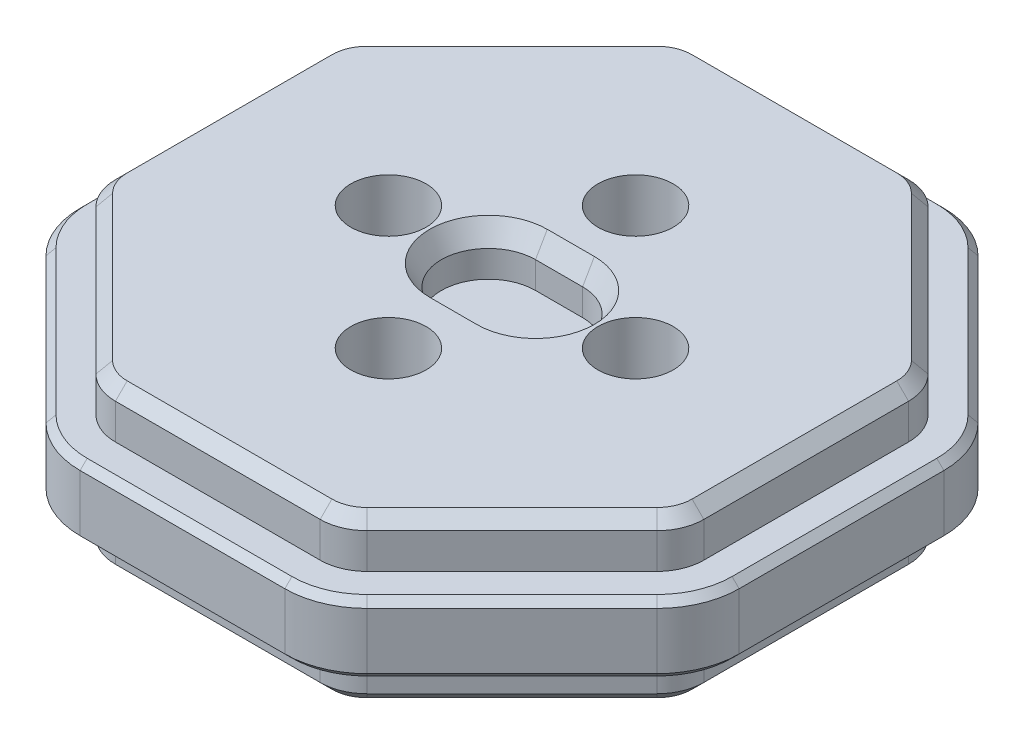
from build123d import *

# Parameters (mm, degrees)
EXTRUDE_1_DEPTH              = 7
HOLE_WIZARD_M3_2_D           = 3.2
HOLE_WIZARD_M3_2_DEPTH       = 7
HOLE_WIZARD_M3_2_CBORE_D     = 6.2
HOLE_WIZARD_M3_2_CBORE_DEPTH = 1.3
HOLE_WIZARD_M3_2_TIP         = 0.96137699
CUT_EXTRUDE_1_DEPTH          = 2
EXTRUDE_START                = -3.5
EXTRUDE_3_DEPTH              = 1.5
FILLET_1_R                   = 2
CHAMFER_1_SIZE               = 0.5
CHAMFER_1_SIZE2              = 0.866025404
FILLET_2_R                   = 1
CHAMFER_2_SIZE               = 0.5
DELETE_START                 = 2
DELETE_FACE_1_DEPTH          = 3
DELETE_FACE_2_DEPTH          = 3
FILLET_3_R                   = 3.5
CHAMFER_3_SIZE               = 0.3


with BuildPart() as part:
    # 草图1 → 凸台-拉伸1 (new body)
    with BuildSketch(Plane(origin=(0, 0, 0), x_dir=(1, 0, 0), z_dir=(0, 1, 0))):
        Polygon((12.5, -5.17766953), (12.5, 5.17766953), (5.17766953, 12.5), (-5.17766953, 12.5), (-12.5, 5.17766953), (-12.5, -5.17766953), (-5.17766953, -12.5), (5.17766953, -12.5), align=None)
    extrude(amount=EXTRUDE_1_DEPTH)

    # M3 六角圆柱头螺钉的柱形沉头孔2
    with Locations(Plane.XZ):
        with Locations((-5.25, 0), (0, 5.25), (5.25, 0), (0, -5.25)):
            CounterBoreHole(HOLE_WIZARD_M3_2_D / 2, HOLE_WIZARD_M3_2_CBORE_D / 2, HOLE_WIZARD_M3_2_CBORE_DEPTH, depth=HOLE_WIZARD_M3_2_DEPTH)
            with Locations((0, 0, -(HOLE_WIZARD_M3_2_DEPTH + HOLE_WIZARD_M3_2_TIP / 2))):  # 118° drill point
                Cone(0, HOLE_WIZARD_M3_2_D / 2, HOLE_WIZARD_M3_2_TIP, mode=Mode.SUBTRACT)

    # 草图7 → 切除-拉伸1 (cut)
    with BuildSketch(Plane(origin=(0, 7, 0), x_dir=(1, 0, 0), z_dir=(0, 1, 0))):
        with BuildLine():
            Line((-1, 2), (1, 2))
            ThreePointArc((1, 2), (3, 0), (1, -2))
            Line((1, -2), (-1, -2))
            ThreePointArc((-1, -2), (-3, 0), (-1, 2))
        make_face()
    extrude(amount=-CUT_EXTRUDE_1_DEPTH, mode=Mode.SUBTRACT)

    # 草图8 → 凸台-拉伸3 (add, symmetric)
    with BuildSketch(Plane(origin=(0, 7, 0), x_dir=(1, 0, 0), z_dir=(0, 1, 0)).offset(EXTRUDE_START)):
        Polygon((5.798989873, 14), (-5.798989873, 14), (-14, 5.798989873), (-14, -5.798989873), (-5.798989873, -14), (5.798989873, -14), (14, -5.798989873), (14, 5.798989873), align=None)
        Polygon((12.5, 5.17766953), (5.17766953, 12.5), (-5.17766953, 12.5), (-12.5, 5.17766953), (-12.5, -5.17766953), (-5.17766953, -12.5), (5.17766953, -12.5), (12.5, -5.17766953), align=None, mode=Mode.SUBTRACT)
    extrude(amount=EXTRUDE_3_DEPTH, both=True)

    # 圆角1
    fillet_1_edges = [part.edges().sort_by_distance(p)[0] for p in [
        (5.17766953, 6, 12.5),
        (-5.17766953, 6, 12.5),
        (-12.5, 6, 5.17766953),
        (-12.5, 6, -5.17766953),
        (-5.17766953, 6, -12.5),
        (5.17766953, 6, -12.5),
        (12.5, 6, -5.17766953),
        (12.5, 6, 5.17766953),
        (5.17766953, 1, 12.5),
        (-5.17766953, 1, 12.5),
        (-12.5, 1, 5.17766953),
        (-12.5, 1, -5.17766953),
        (-5.17766953, 1, -12.5),
        (5.17766953, 1, -12.5),
        (12.5, 1, -5.17766953),
        (12.5, 1, 5.17766953),
        (14, 3.5, -5.798989873),
        (5.798989873, 3.5, -14),
        (-5.798989873, 3.5, -14),
        (-14, 3.5, -5.798989873),
        (-14, 3.5, 5.798989873),
        (-5.798989873, 3.5, 14),
        (5.798989873, 3.5, 14),
        (14, 3.5, 5.798989873),
    ]]
    fillet(fillet_1_edges, radius=FILLET_1_R)

    # 倒角1
    chamfer_1_edges = [part.edges().sort_by_distance(p)[0] for p in [
        (-3, 7, 0),
        (0, 7, 2),
        (3, 7, 0),
        (0, 7, -2),
    ]]
    chamfer_1_side = [part.faces().sort_by_distance(p)[0] for p in [
        (12.146446609, 7, 0),
    ]]
    chamfer(chamfer_1_edges, length=CHAMFER_1_SIZE, length2=CHAMFER_1_SIZE2, reference=chamfer_1_side[0])

    # 圆角2
    fillet_2_edges = [part.edges().sort_by_distance(p)[0] for p in [
        (9.899494937, 2, -9.899494937),
        (9.899494937, 5, -9.899494937),
        (14, 2, 0),
        (9.899494937, 2, 9.899494937),
        (0, 2, 14),
        (-9.899494937, 2, 9.899494937),
        (-14, 2, 0),
        (-9.899494937, 2, -9.899494937),
        (0, 2, -14),
        (-13.847759065, 2, -5.735929613),
        (5.735929613, 2, -13.847759065),
        (-5.735929613, 2, -13.847759065),
        (-13.847759065, 2, 5.735929613),
        (-5.735929613, 2, 13.847759065),
        (5.735929613, 2, 13.847759065),
        (13.847759065, 2, 5.735929613),
        (13.847759065, 2, -5.735929613),
        (14, 5, 0),
        (0, 5, -14),
        (-9.899494937, 5, -9.899494937),
        (-14, 5, 0),
        (-9.899494937, 5, 9.899494937),
        (0, 5, 14),
        (9.899494937, 5, 9.899494937),
        (-13.847759065, 5, -5.735929613),
        (5.735929613, 5, -13.847759065),
        (-5.735929613, 5, -13.847759065),
        (-13.847759065, 5, 5.735929613),
        (-5.735929613, 5, 13.847759065),
        (5.735929613, 5, 13.847759065),
        (13.847759065, 5, 5.735929613),
        (13.847759065, 5, -5.735929613),
    ]]
    fillet(fillet_2_edges, radius=FILLET_2_R)

    # 倒角2
    chamfer_2_edges = [part.edges().sort_by_distance(p)[0] for p in [
        (12.5, 0, 0),
        (8.838834765, 0, 8.838834765),
        (0, 0, 12.5),
        (-8.838834765, 0, 8.838834765),
        (-12.5, 0, 0),
        (-8.838834765, 0, -8.838834765),
        (0, 0, -12.5),
        (8.838834765, 0, -8.838834765),
        (-12.347759065, 0, -5.11460927),
        (12.347759065, 0, -5.11460927),
        (5.11460927, 0, -12.347759065),
        (-5.11460927, 0, -12.347759065),
        (-12.347759065, 0, 5.11460927),
        (-5.11460927, 0, 12.347759065),
        (5.11460927, 0, 12.347759065),
        (12.347759065, 0, 5.11460927),
        (0, 7, 12.5),
        (-8.838834765, 7, 8.838834765),
        (8.838834765, 7, 8.838834765),
        (12.5, 7, 0),
        (8.838834765, 7, -8.838834765),
        (0, 7, -12.5),
        (-8.838834765, 7, -8.838834765),
        (-12.5, 7, 0),
        (12.347759065, 7, 5.11460927),
        (5.11460927, 7, 12.347759065),
        (12.347759065, 7, -5.11460927),
        (5.11460927, 7, -12.347759065),
        (-5.11460927, 7, -12.347759065),
        (-12.347759065, 7, -5.11460927),
        (-12.347759065, 7, 5.11460927),
        (-5.11460927, 7, 12.347759065),
    ]]
    chamfer(chamfer_2_edges, length=CHAMFER_2_SIZE)

    # Delete Face 1: read off the stored shape, not the designer's step
    # Delete Face 1 outline → Delete Face 1 (add)
    with BuildSketch(Plane(origin=(0, 0, 0), x_dir=(1, 0, 0), z_dir=(0, 1, 0)).offset(DELETE_START)):
        with BuildLine():
            ThreePointArc((13.414213562, -6.384776311), (13.847759065, -5.735929613), (14, -4.970562748))
            Line((14, -4.970562748), (14, 4.970562748))
            ThreePointArc((14, 4.970562748), (13.847759065, 5.735929613), (13.414213562, 6.384776311))
            Line((13.414213562, 6.384776311), (6.384776311, 13.414213562))
            ThreePointArc((6.384776311, 13.414213562), (5.735929613, 13.847759065), (4.970562748, 14))
            Line((4.970562748, 14), (-4.970562748, 14))
            ThreePointArc((-4.970562748, 14), (-5.735929613, 13.847759065), (-6.384776311, 13.414213562))
            Line((-6.384776311, 13.414213562), (-13.414213562, 6.384776311))
            ThreePointArc((-13.414213562, 6.384776311), (-13.847759065, 5.735929613), (-14, 4.970562748))
            Line((-14, 4.970562748), (-14, -4.970562748))
            ThreePointArc((-14, -4.970562748), (-13.847759065, -5.735929613), (-13.414213562, -6.384776311))
            Line((-13.414213562, -6.384776311), (-6.384776311, -13.414213562))
            ThreePointArc((-6.384776311, -13.414213562), (-5.735929613, -13.847759065), (-4.970562748, -14))
            Line((-4.970562748, -14), (4.970562748, -14))
            ThreePointArc((4.970562748, -14), (5.735929613, -13.847759065), (6.384776311, -13.414213562))
            Line((6.384776311, -13.414213562), (13.414213562, -6.384776311))
        make_face()
        with BuildLine():
            ThreePointArc((4.349242405, 12.5), (5.11460927, 12.347759065), (5.763455967, 11.914213562))
            Line((5.763455967, 11.914213562), (11.914213562, 5.763455967))
            ThreePointArc((11.914213562, 5.763455967), (12.347759065, 5.11460927), (12.5, 4.349242405))
            Line((12.5, 4.349242405), (12.5, -4.349242405))
            ThreePointArc((12.5, -4.349242405), (12.347759065, -5.11460927), (11.914213562, -5.763455967))
            Line((11.914213562, -5.763455967), (5.763455967, -11.914213562))
            ThreePointArc((5.763455967, -11.914213562), (5.11460927, -12.347759065), (4.349242405, -12.5))
            Line((4.349242405, -12.5), (-4.349242405, -12.5))
            ThreePointArc((-4.349242405, -12.5), (-5.11460927, -12.347759065), (-5.763455967, -11.914213562))
            Line((-5.763455967, -11.914213562), (-11.914213562, -5.763455967))
            ThreePointArc((-11.914213562, -5.763455967), (-12.347759065, -5.11460927), (-12.5, -4.349242405))
            Line((-12.5, -4.349242405), (-12.5, 4.349242405))
            ThreePointArc((-12.5, 4.349242405), (-12.347759065, 5.11460927), (-11.914213562, 5.763455967))
            Line((-11.914213562, 5.763455967), (-5.763455967, 11.914213562))
            ThreePointArc((-5.763455967, 11.914213562), (-5.11460927, 12.347759065), (-4.349242405, 12.5))
            Line((-4.349242405, 12.5), (4.349242405, 12.5))
        make_face(mode=Mode.SUBTRACT)
    extrude(amount=DELETE_FACE_1_DEPTH)

    # Delete Face 2: read off the stored shape, not the designer's step
    # Delete Face 2 outline → Delete Face 2 (add)
    with BuildSketch(Plane(origin=(0, 0, 0), x_dir=(1, 0, 0), z_dir=(0, 1, 0)).offset(DELETE_START)):
        with BuildLine():
            Line((14, 5.798989873), (13.414213562, 6.384776311))
            ThreePointArc((13.414213562, 6.384776311), (13.847759065, 5.735929613), (14, 4.970562748))
            Line((14, 4.970562748), (14, 5.798989873))
        make_face()
        with BuildLine():
            ThreePointArc((4.970562748, 14), (5.735929613, 13.847759065), (6.384776311, 13.414213562))
            Line((6.384776311, 13.414213562), (5.798989873, 14))
            Line((5.798989873, 14), (4.970562748, 14))
        make_face()
        with BuildLine():
            Line((14, -5.798989873), (14, -4.970562748))
            ThreePointArc((14, -4.970562748), (13.847759065, -5.735929613), (13.414213562, -6.384776311))
            Line((13.414213562, -6.384776311), (14, -5.798989873))
        make_face()
        with BuildLine():
            ThreePointArc((-6.384776311, 13.414213562), (-5.735929613, 13.847759065), (-4.970562748, 14))
            Line((-4.970562748, 14), (-5.798989873, 14))
            Line((-5.798989873, 14), (-6.384776311, 13.414213562))
        make_face()
        with BuildLine():
            Line((5.798989873, -14), (6.384776311, -13.414213562))
            ThreePointArc((6.384776311, -13.414213562), (5.735929613, -13.847759065), (4.970562748, -14))
            Line((4.970562748, -14), (5.798989873, -14))
        make_face()
        with BuildLine():
            ThreePointArc((-14, 4.970562748), (-13.847759065, 5.735929613), (-13.414213562, 6.384776311))
            Line((-13.414213562, 6.384776311), (-14, 5.798989873))
            Line((-14, 5.798989873), (-14, 4.970562748))
        make_face()
        with BuildLine():
            Line((-5.798989873, -14), (-4.970562748, -14))
            ThreePointArc((-4.970562748, -14), (-5.735929613, -13.847759065), (-6.384776311, -13.414213562))
            Line((-6.384776311, -13.414213562), (-5.798989873, -14))
        make_face()
        with BuildLine():
            ThreePointArc((-13.414213562, -6.384776311), (-13.847759065, -5.735929613), (-14, -4.970562748))
            Line((-14, -4.970562748), (-14, -5.798989873))
            Line((-14, -5.798989873), (-13.414213562, -6.384776311))
        make_face()
    extrude(amount=DELETE_FACE_2_DEPTH)

    # 圆角3
    fillet_3_edges = [part.edges().sort_by_distance(p)[0] for p in [
        (14, 3.5, -5.798989873),
        (14, 3.5, 5.798989873),
        (5.798989873, 3.5, 14),
        (-5.798989873, 3.5, 14),
        (-14, 3.5, 5.798989873),
        (-14, 3.5, -5.798989873),
        (-5.798989873, 3.5, -14),
        (5.798989873, 3.5, -14),
    ]]
    fillet(fillet_3_edges, radius=FILLET_3_R)

    # 倒角3
    chamfer_3_edges = [part.edges().sort_by_distance(p)[0] for p in [
        (9.899494937, 2, 9.899494936),
        (9.899494937, 5, 9.899494936),
        (9.899494936, 2, -9.899494937),
        (14, 2, 0),
        (0, 2, 14),
        (-9.899494936, 2, 9.899494937),
        (-14, 2, 0),
        (-9.899494937, 2, -9.899494936),
        (0, 2, -14),
        (-5.688634418, 2, 13.733578364),
        (-13.733578364, 2, 5.688634418),
        (-13.733578364, 2, -5.688634418),
        (-5.688634418, 2, -13.733578364),
        (5.688634418, 2, -13.733578364),
        (13.733578364, 2, -5.688634418),
        (13.733578364, 2, 5.688634418),
        (5.688634418, 2, 13.733578364),
        (0, 5, 14),
        (14, 5, 0),
        (9.899494936, 5, -9.899494937),
        (0, 5, -14),
        (-9.899494937, 5, -9.899494936),
        (-14, 5, 0),
        (-9.899494936, 5, 9.899494937),
        (-5.688634418, 5, 13.733578364),
        (-13.733578364, 5, 5.688634418),
        (-13.733578364, 5, -5.688634418),
        (-5.688634418, 5, -13.733578364),
        (5.688634418, 5, -13.733578364),
        (13.733578364, 5, -5.688634418),
        (13.733578364, 5, 5.688634418),
        (5.688634418, 5, 13.733578364),
    ]]
    chamfer(chamfer_3_edges, length=CHAMFER_3_SIZE)


solid = part.part
